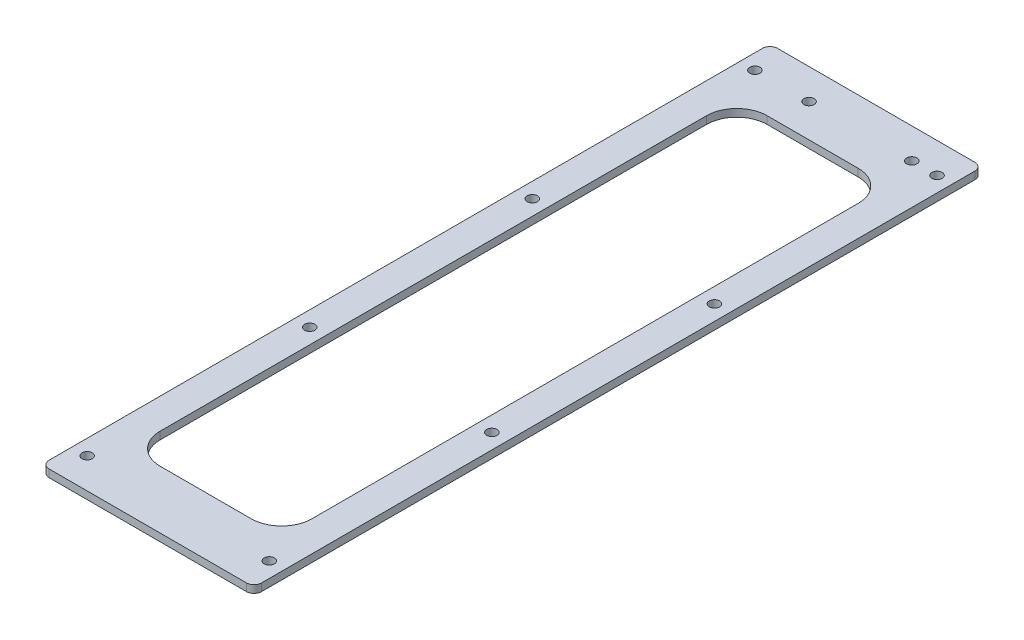
from build123d import *

# Parameters (mm, degrees)
SKETCH1_W           = 88.9
SKETCH1_H           = 304.8
SKETCH1_W_2         = 63.5
SKETCH1_H_2         = 254
BOSS_EXTRUDE1_DEPTH = 3.175
SKETCH7_R           = 2.159
CUT_EXTRUDE2_DEPTH  = 159.781746826
FILLET1_R           = 12.7
FILLET3_R           = 3.175
SKETCH9_R           = 2.159
CUT_EXTRUDE4_DEPTH  = 159.781746826


with BuildPart() as part:
    # Sketch1 → Boss-Extrude1 (new body)
    with BuildSketch(Plane(origin=(0, 0, 0), x_dir=(1, 0, 0), z_dir=(0, 1, 0))):
        Rectangle(SKETCH1_W, SKETCH1_H)
        with Locations((0, -1.176932577)):
            Rectangle(SKETCH1_W_2, SKETCH1_H_2, mode=Mode.SUBTRACT)
    extrude(amount=BOSS_EXTRUDE1_DEPTH)

    # Sketch7 → Cut-Extrude2 (cut, through all)
    with BuildSketch(Plane(origin=(0, 3.175, 0), x_dir=(1, 0, 0), z_dir=(0, 1, 0))):
        with Locations((-38.1, 139.736298381)):
            Circle(SKETCH7_R)
        with Locations((38.1, 139.736298381)):
            Circle(SKETCH7_R)
        with Locations((-38.1, 46.602880381)):
            Circle(SKETCH7_R)
        with Locations((-38.1, -46.530537619)):
            Circle(SKETCH7_R)
        with Locations((-38.1, -139.663955619)):
            Circle(SKETCH7_R)
        with Locations((38.1, 46.602118381)):
            Circle(SKETCH7_R)
        with Locations((38.1, -46.532061619)):
            Circle(SKETCH7_R)
        with Locations((38.1, -139.666241619)):
            Circle(SKETCH7_R)
    extrude(amount=-CUT_EXTRUDE2_DEPTH, mode=Mode.SUBTRACT)

    # Fillet1
    fillet1_edges = [part.edges().sort_by_distance(p)[0] for p in [
        (31.75, 1.5875, 128.176932577),
        (-31.75, 1.5875, 128.176932577),
        (-31.75, 1.5875, -125.823067423),
        (31.75, 1.5875, -125.823067423),
    ]]
    fillet(fillet1_edges, radius=FILLET1_R)

    # Fillet3
    fillet3_edges = [part.edges().sort_by_distance(p)[0] for p in [
        (-44.45, 1.5875, 152.4),
        (44.45, 1.5875, 152.4),
        (44.45, 1.5875, -152.4),
        (-44.45, 1.5875, -152.4),
    ]]
    fillet(fillet3_edges, radius=FILLET3_R)

    # Sketch9 → Cut-Extrude4 (cut, through all)
    with BuildSketch(Plane(origin=(0, 3.175, 0), x_dir=(1, 0, 0), z_dir=(0, 1, 0))):
        with Locations((-15.4178, 139.7)):
            Circle(SKETCH9_R)
        with Locations((27.5844, 139.7)):
            Circle(SKETCH9_R)
    extrude(amount=-CUT_EXTRUDE4_DEPTH, mode=Mode.SUBTRACT)


solid = part.part
